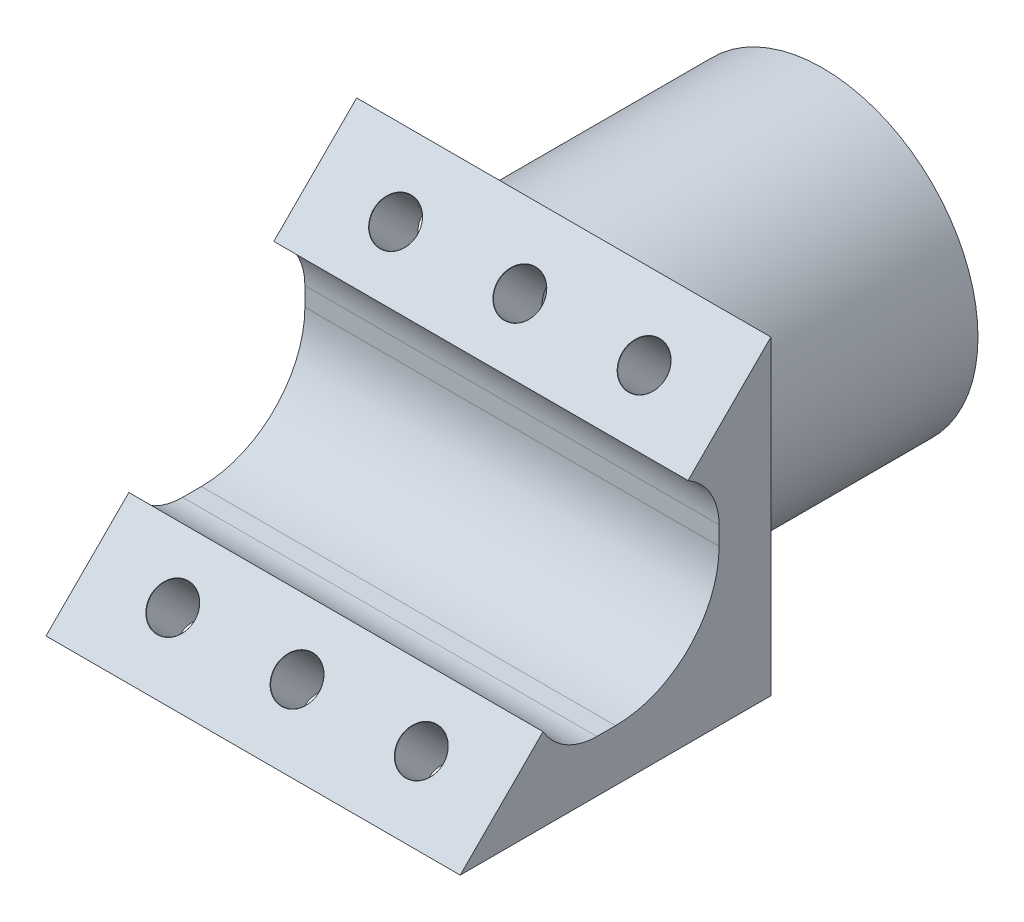
from build123d import *

# Parameters (mm, degrees)
SKETCH1_R                            = 15
SKETCH1_R_2                          = 10
BOSS_EXTRUDE1_DEPTH                  = 25
SKETCH2_W                            = 40
SKETCH2_H                            = 30
BOSS_EXTRUDE2_DEPTH                  = 30
SKETCH3_R                            = 10
CUT_EXTRUDE1_DEPTH                   = 70.641941386
CUT_EXTRUDE2_DEPTH                   = 70.641941386
CUT_EXTRUDE6_DEPTH                   = 70.641941386
BOSS_EXTRUDE3_DEPTH                  = 40
FILLET1_R                            = 6
F_4_2_4_2_DIAMETER_HOLE1_D           = 4.2
F_4_2_4_2_DIAMETER_HOLE1_DEPTH       = 6
F_4_2_4_2_DIAMETER_HOLE1_CSINK_D     = 4.25
F_4_2_4_2_DIAMETER_HOLE1_CSINK_ANGLE = 90
F_4_2_4_2_DIAMETER_HOLE1_TIP         = 1.2618073


with BuildPart() as part:
    # Sketch1 → Boss-Extrude1 (new body)
    with BuildSketch(Plane.XY):
        Circle(SKETCH1_R)
        Circle(SKETCH1_R_2, mode=Mode.SUBTRACT)
    extrude(amount=BOSS_EXTRUDE1_DEPTH)

    # Sketch2 → Boss-Extrude2 (add)
    with BuildSketch(Plane.XY.offset(25)):
        Rectangle(SKETCH2_W, SKETCH2_H)
    extrude(amount=BOSS_EXTRUDE2_DEPTH)

    # Sketch3 → Cut-Extrude1 (cut, through all)
    with BuildSketch(Plane.ZY.offset(20)):
        with Locations(Location((40, 0, 0), (0, 0, 270))):
            Circle(SKETCH3_R)
    extrude(amount=-CUT_EXTRUDE1_DEPTH, mode=Mode.SUBTRACT)

    # Sketch4 → Cut-Extrude2 (cut, through all)
    with BuildSketch(Plane(origin=(20, 0, 0), x_dir=(0, 0, -1), z_dir=(1, 0, 0))):
        with BuildLine():
            Line((-30, 0), (-30, 15))
            Line((-30, 15), (-55, 15))
            Line((-55, 15), (-55, -10))
            Line((-55, -10), (-40, -10))
            ThreePointArc((-40, -10), (-32.928932188, -7.071067812), (-30, 0))
        make_face()
    extrude(amount=-CUT_EXTRUDE2_DEPTH, mode=Mode.SUBTRACT)

    # Sketch6 → Cut-Extrude6 (cut, through all)
    with BuildSketch(Plane(origin=(20, 0, 0), x_dir=(0, 0, -1), z_dir=(1, 0, 0))):
        Polygon((-25, 15), (-30, 10), (-30, 15), align=None)
        Polygon((-55, -10), (-55, -15), (-50, -10), align=None)
    extrude(amount=-CUT_EXTRUDE6_DEPTH, mode=Mode.SUBTRACT)

    # Sketch7 → Boss-Extrude3 (add)
    with BuildSketch(Plane.ZY.offset(20)):
        Polygon((30, 10), (33, 7), (30, 7), align=None)
        Polygon((50, -10), (47, -7), (47, -10), align=None)
    extrude(amount=-BOSS_EXTRUDE3_DEPTH)

    # Fillet1
    # the kernel refuses this fillet: 6 mm, written as the material it adds along each edge
    with BuildSketch(Plane(origin=(-20, -10, 47), x_dir=(0, 1, 0), z_dir=(1, 0, 0))) as fillet1_piece_1_section:
        with BuildLine():
            CenterArc((6, -5.196152423), FILLET1_R, 120, 60)
            Line((0, -5.196152423), (-0.12, -5.196152423))
            Line((-0.12, -5.196152423), (-0.12, 0))
            Line((-0.12, 0), (0, 0.12))
            ThreePointArc((0, 0.12), (1.5, 0.12), (2.94, 0.103923048))
            Line((2.94, 0.103923048), (3, 0))
        make_face()
    fillet1_piece_1 = extrude(amount=40, mode=Mode.PRIVATE)
    fillet1_piece_1 = split(fillet1_piece_1, bisect_by=Plane(origin=(0, -7.462685522, 47.462685522), z_dir=(0, -0.7071067811865475, -0.7071067811865477)), keep=Keep.TOP, mode=Mode.PRIVATE)
    add(fillet1_piece_1)
    with BuildSketch(Plane(origin=(-20, 7, 30), x_dir=(0, -1, 0), z_dir=(1, 0, 0))) as fillet1_piece_2_section:
        with BuildLine():
            CenterArc((5.196152423, -6), FILLET1_R, 90, 60)
            Line((0, -3), (-0.103923048, -2.94))
            ThreePointArc((-0.103923048, -2.94), (-0.12, -1.5), (-0.12, 0))
            Line((-0.12, 0), (0, 0.12))
            Line((0, 0.12), (5.196152423, 0.12))
            Line((5.196152423, 0.12), (5.196152423, 0))
        make_face()
    fillet1_piece_2 = extrude(amount=40, mode=Mode.PRIVATE)
    fillet1_piece_2 = split(fillet1_piece_2, bisect_by=Plane(origin=(0, 7.462685522, 32.537314478), z_dir=(0, -0.7071067811865477, -0.7071067811865475)), keep=Keep.TOP, mode=Mode.PRIVATE)
    add(fillet1_piece_2)

    # Ø4.2 (4.2) Diameter Hole1
    with Locations(Plane(origin=(0, 20, 20), x_dir=(1, 0, 0), z_dir=(0, 0.7071067811865475, 0.7071067811865477))):
        with Locations((12, -43.497474683), (0, -43.497474683), (-12, -43.497474683), (-12, -13.071067812), (0, -13.071067812), (12, -13.071067812)):
            CounterSinkHole(F_4_2_4_2_DIAMETER_HOLE1_D / 2, F_4_2_4_2_DIAMETER_HOLE1_CSINK_D / 2, depth=F_4_2_4_2_DIAMETER_HOLE1_DEPTH, counter_sink_angle=F_4_2_4_2_DIAMETER_HOLE1_CSINK_ANGLE)
            with Locations((0, 0, -(F_4_2_4_2_DIAMETER_HOLE1_DEPTH + F_4_2_4_2_DIAMETER_HOLE1_TIP / 2))):  # 118° drill point
                Cone(0, F_4_2_4_2_DIAMETER_HOLE1_D / 2, F_4_2_4_2_DIAMETER_HOLE1_TIP, mode=Mode.SUBTRACT)


solid = part.part
